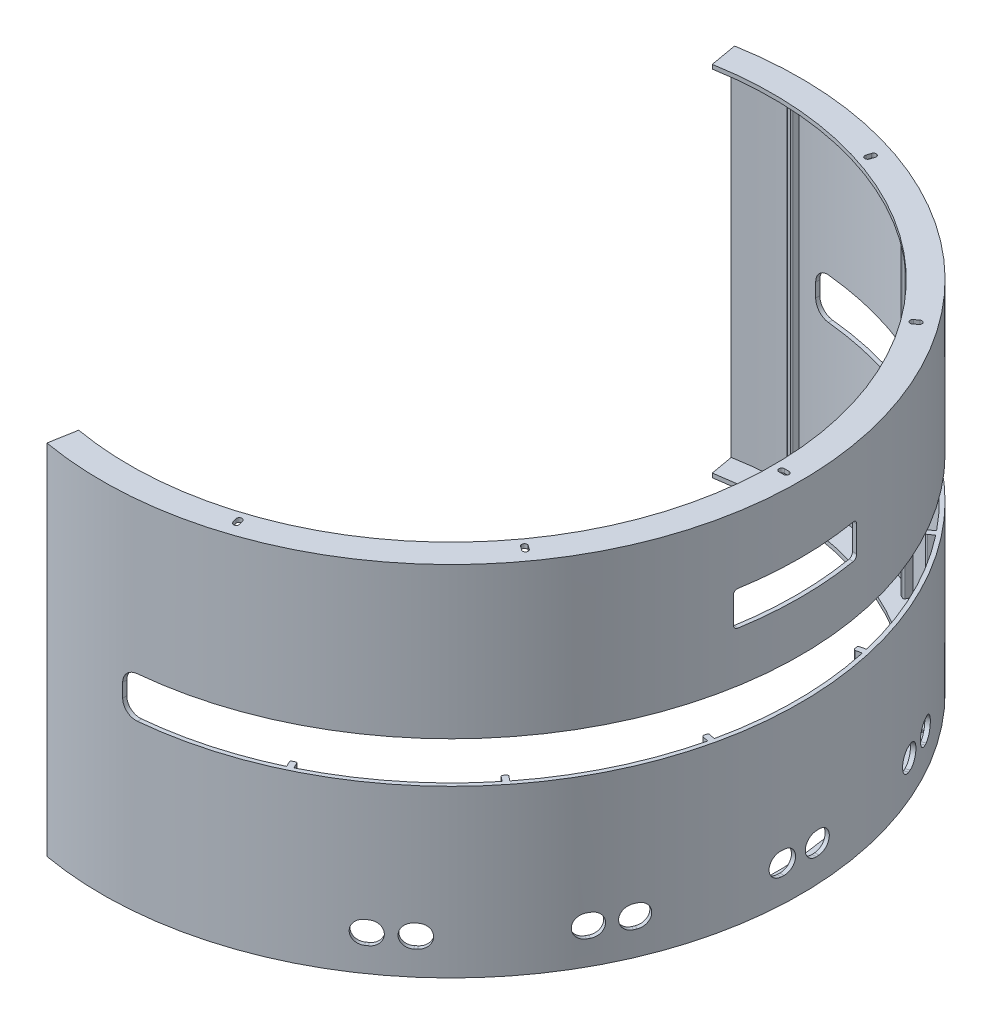
from build123d import *

# Parameters (mm, degrees)
BOSS_EXTRUDE1_DEPTH   = 255
BOSS_EXTRUDE2_DEPTH   = 255
BOSS_EXTRUDE2_2_DEPTH = 255
BOSS_EXTRUDE2_3_DEPTH = 255
BOSS_EXTRUDE2_4_DEPTH = 255
BOSS_EXTRUDE2_5_DEPTH = 255
BOSS_EXTRUDE2_6_DEPTH = 255
BOSS_EXTRUDE2_7_DEPTH = 255
BOSS_EXTRUDE2_8_DEPTH = 255
SKETCH4_W             = 480
SKETCH4_H             = 30
CUT_EXTRUDE2_DEPTH    = 476.5
FILLET2_R             = 10
BOSS_EXTRUDE3_DEPTH   = 3
CUT_EXTRUDE3_DEPTH    = 5
LPATTERN1_COUNT       = 2
LPATTERN1_PITCH       = 258
LPATTERN2_COUNT       = 2
LPATTERN2_PITCH       = 258
SKETCH9_W             = 27.100731328
SKETCH9_H             = 25
CUT_EXTRUDE4_DEPTH    = 45
FILLET3_R             = 3
CUT_EXTRUDE5_DEPTH    = 600
CIRPATTERN1_COUNT     = 3
CIRPATTERN1_ANGLE     = 52
CIRPATTERN2_COUNT     = 3
CIRPATTERN2_ANGLE     = 52


with BuildPart() as part:
    # Sketch3 → Boss-Extrude1 (new body)
    with BuildSketch(Plane(origin=(0, 0, 0), x_dir=(1, 0, 0), z_dir=(0, 1, 0))):
        with BuildLine():
            ThreePointArc((0, 251.5), (251.5, 0), (0, -251.5))
            ThreePointArc((0, -251.5), (-21.919669301, -250.54296657), (-43.672516683, -247.679149883))
            Line((-43.672516683, -247.679149883), (-44.193461216, -250.633573142))
            ThreePointArc((-44.193461216, -250.633573142), (-22.181136529, -253.531550664), (0, -254.5))
            ThreePointArc((0, -254.5), (254.5, 0), (0, 254.5))
            ThreePointArc((0, 254.5), (-22.181136529, 253.531550664), (-44.193461216, 250.633573142))
            Line((-44.193461216, 250.633573142), (-43.672516683, 247.679149883))
            ThreePointArc((-43.672516683, 247.679149883), (-21.919669301, 250.54296657), (0, 251.5))
        make_face()
    extrude(amount=BOSS_EXTRUDE1_DEPTH)


with BuildPart() as body_2:
    # Sketch6 → Boss-Extrude2 (new body)
    with BuildSketch(Plane(origin=(0, 255, 0), x_dir=(1, 0, 0), z_dir=(0, 1, 0))):
        with BuildLine():
            Line((-2, 253.081926056), (-2, 247.081926056))
            ThreePointArc((-2, 247.081926056), (-1.707106781, 246.374819275), (-1, 246.081926056))
            Line((-1, 246.081926056), (1, 246.081926056))
            ThreePointArc((1, 246.081926056), (1.707106781, 246.374819275), (2, 247.081926056))
            Line((2, 247.081926056), (2, 253.081926056))
            Line((2, 253.081926056), (-2, 253.081926056))
        make_face()
    extrude(amount=-BOSS_EXTRUDE2_DEPTH)


with BuildPart() as body_3:
    # Sketch6 → Boss-Extrude2 2 (new body)
    with BuildSketch(Plane(origin=(0, 255, 0), x_dir=(1, 0, 0), z_dir=(0, 1, 0))):
        with BuildLine():
            Line((108.006194645, 228.886703884), (105.40289221, 223.480890676))
            ThreePointArc((105.40289221, 223.480890676), (105.359977747, 222.716727875), (105.869977339, 222.146038069))
            Line((105.869977339, 222.146038069), (107.671915074, 221.278270591))
            ThreePointArc((107.671915074, 221.278270591), (108.436077876, 221.235356129), (109.006767681, 221.74535572))
            Line((109.006767681, 221.74535572), (111.610070116, 227.151168927))
            Line((111.610070116, 227.151168927), (108.006194645, 228.886703884))
        make_face()
    extrude(amount=-BOSS_EXTRUDE2_2_DEPTH)


with BuildPart() as body_4:
    # Sketch6 → Boss-Extrude2 3 (new body)
    with BuildSketch(Plane(origin=(0, 255, 0), x_dir=(1, 0, 0), z_dir=(0, 1, 0))):
        with BuildLine():
            Line((196.620437831, 159.357662896), (191.929448936, 155.616724085))
            ThreePointArc((191.929448936, 155.616724085), (191.559226528, 154.946857078), (191.771107255, 154.2114028))
            Line((191.771107255, 154.2114028), (193.018086859, 152.647739835))
            ThreePointArc((193.018086859, 152.647739835), (193.687953865, 152.277517427), (194.423408143, 152.489398155))
            Line((194.423408143, 152.489398155), (199.114397038, 156.230336966))
            Line((199.114397038, 156.230336966), (196.620437831, 159.357662896))
        make_face()
    extrude(amount=-BOSS_EXTRUDE2_3_DEPTH)


with BuildPart() as body_5:
    # Sketch6 → Boss-Extrude2 4 (new body)
    with BuildSketch(Plane(origin=(0, 255, 0), x_dir=(1, 0, 0), z_dir=(0, 1, 0))):
        with BuildLine():
            Line((246.291591913, 58.265882378), (240.44202444, 56.930756774))
            ThreePointArc((240.44202444, 56.930756774), (239.817821175, 56.487860938), (239.689617462, 55.733307928))
            Line((239.689617462, 55.733307928), (240.13465933, 53.783452104))
            ThreePointArc((240.13465933, 53.783452104), (240.577555165, 53.159248838), (241.332108176, 53.031045125))
            Line((241.332108176, 53.031045125), (247.181675649, 54.366170729))
            Line((247.181675649, 54.366170729), (246.291591913, 58.265882378))
        make_face()
    extrude(amount=-BOSS_EXTRUDE2_4_DEPTH)


with BuildPart() as body_6:
    # Sketch6 → Boss-Extrude2 5 (new body)
    with BuildSketch(Plane(origin=(0, 255, 0), x_dir=(1, 0, 0), z_dir=(0, 1, 0))):
        with BuildLine():
            Line((247.181675649, -54.366170729), (241.332108176, -53.031045125))
            ThreePointArc((241.332108176, -53.031045125), (240.577555165, -53.159248838), (240.13465933, -53.783452104))
            Line((240.13465933, -53.783452104), (239.689617462, -55.733307928))
            ThreePointArc((239.689617462, -55.733307928), (239.817821175, -56.487860938), (240.44202444, -56.930756774))
            Line((240.44202444, -56.930756774), (246.291591913, -58.265882378))
            Line((246.291591913, -58.265882378), (247.181675649, -54.366170729))
        make_face()
    extrude(amount=-BOSS_EXTRUDE2_5_DEPTH)


with BuildPart() as body_7:
    # Sketch6 → Boss-Extrude2 6 (new body)
    with BuildSketch(Plane(origin=(0, 255, 0), x_dir=(1, 0, 0), z_dir=(0, 1, 0))):
        with BuildLine():
            Line((199.114397038, -156.230336966), (194.423408143, -152.489398155))
            ThreePointArc((194.423408143, -152.489398155), (193.687953865, -152.277517427), (193.018086859, -152.647739835))
            Line((193.018086859, -152.647739835), (191.771107255, -154.2114028))
            ThreePointArc((191.771107255, -154.2114028), (191.559226528, -154.946857078), (191.929448936, -155.616724085))
            Line((191.929448936, -155.616724085), (196.620437831, -159.357662896))
            Line((196.620437831, -159.357662896), (199.114397038, -156.230336966))
        make_face()
    extrude(amount=-BOSS_EXTRUDE2_6_DEPTH)


with BuildPart() as body_8:
    # Sketch6 → Boss-Extrude2 7 (new body)
    with BuildSketch(Plane(origin=(0, 255, 0), x_dir=(1, 0, 0), z_dir=(0, 1, 0))):
        with BuildLine():
            Line((111.610070116, -227.151168927), (109.006767681, -221.74535572))
            ThreePointArc((109.006767681, -221.74535572), (108.436077876, -221.235356129), (107.671915074, -221.278270591))
            Line((107.671915074, -221.278270591), (105.869977339, -222.146038069))
            ThreePointArc((105.869977339, -222.146038069), (105.359977747, -222.716727875), (105.40289221, -223.480890676))
            Line((105.40289221, -223.480890676), (108.006194645, -228.886703884))
            Line((108.006194645, -228.886703884), (111.610070116, -227.151168927))
        make_face()
    extrude(amount=-BOSS_EXTRUDE2_7_DEPTH)


with BuildPart() as body_9:
    # Sketch6 → Boss-Extrude2 8 (new body)
    with BuildSketch(Plane(origin=(0, 255, 0), x_dir=(1, 0, 0), z_dir=(0, 1, 0))):
        with BuildLine():
            Line((2, -253.081926056), (2, -247.081926056))
            ThreePointArc((2, -247.081926056), (1.707106781, -246.374819275), (1, -246.081926056))
            Line((1, -246.081926056), (-1, -246.081926056))
            ThreePointArc((-1, -246.081926056), (-1.707106781, -246.374819275), (-2, -247.081926056))
            Line((-2, -247.081926056), (-2, -253.081926056))
            Line((-2, -253.081926056), (2, -253.081926056))
        make_face()
    extrude(amount=-BOSS_EXTRUDE2_8_DEPTH)


with BuildPart() as body_2_1:
    add(body_2.part)

    # Combine2: union part, body 3, body 4, body 5, body 6, body 7, body 8, body 9
    add(part.part)
    add(body_3.part)
    add(body_4.part)
    add(body_5.part)
    add(body_6.part)
    add(body_7.part)
    add(body_8.part)
    add(body_9.part)

    # Sketch4 → Cut-Extrude2 (cut, symmetric)
    with BuildSketch(Plane.XY):
        with Locations((254.5, 133)):
            Rectangle(SKETCH4_W, SKETCH4_H)
    extrude(amount=CUT_EXTRUDE2_DEPTH, both=True, mode=Mode.SUBTRACT)

    # Fillet2
    fillet2_edges = [body_2_1.edges().sort_by_distance(p)[0] for p in [
        (14.5, 148, -252.584129717),
        (14.5, 118, -252.584129717),
        (14.5, 118, 252.584129717),
        (14.5, 148, 252.584129717),
    ]]
    fillet(fillet2_edges, radius=FILLET2_R)

    # Sketch7 → Boss-Extrude3 (add)
    with BuildSketch(Plane(origin=(0, 255, 0), x_dir=(1, 0, 0), z_dir=(0, 1, 0))):
        with BuildLine():
            ThreePointArc((-44.193461216, -250.633573142), (254.5, 0), (-44.193461216, 250.633573142))
            Line((-44.193461216, 250.633573142), (-40.720497663, 230.937418081))
            ThreePointArc((-40.720497663, 230.937418081), (234.5, 0), (-40.720497663, -230.937418081))
            Line((-40.720497663, -230.937418081), (-44.193461216, -250.633573142))
        make_face()
    boss_extrude3 = extrude(amount=BOSS_EXTRUDE3_DEPTH)

    # Sketch8 → Cut-Extrude3 (cut)
    with BuildSketch(Plane.XZ.offset(-255)):
        with BuildLine():
            Line((240.8, 2), (244.2, 2))
            ThreePointArc((244.2, 2), (246.2, 0), (244.2, -2))
            Line((244.2, -2), (240.8, -2))
            ThreePointArc((240.8, -2), (238.8, 0), (240.8, 2))
        make_face()
        with BuildLine():
            Line((195.98686275, -139.920654763), (198.737520531, -141.919124621))
            ThreePointArc((198.737520531, -141.919124621), (199.179984015, -144.712729114), (196.386379522, -145.155192599))
            Line((196.386379522, -145.155192599), (193.635721741, -143.156722741))
            ThreePointArc((193.635721741, -143.156722741), (193.193258257, -140.363118247), (195.98686275, -139.920654763))
        make_face()
        with BuildLine():
            Line((76.313405278, -228.396375135), (77.364063059, -231.629967291))
            ThreePointArc((77.364063059, -231.629967291), (76.079984015, -234.150114312), (73.559836994, -232.866035268))
            Line((73.559836994, -232.866035268), (72.509179213, -229.632443113))
            ThreePointArc((72.509179213, -229.632443113), (73.793258257, -227.112296091), (76.313405278, -228.396375135))
        make_face()
        with BuildLine():
            Line((-72.509179213, -229.632443113), (-73.559836994, -232.866035268))
            ThreePointArc((-73.559836994, -232.866035268), (-76.079984015, -234.150114312), (-77.364063059, -231.629967291))
            Line((-77.364063059, -231.629967291), (-76.313405278, -228.396375135))
            ThreePointArc((-76.313405278, -228.396375135), (-73.793258257, -227.112296091), (-72.509179213, -229.632443113))
        make_face()
        with BuildLine():
            Line((-193.635721741, -143.156722741), (-196.386379522, -145.155192599))
            ThreePointArc((-196.386379522, -145.155192599), (-199.179984015, -144.712729114), (-198.737520531, -141.919124621))
            Line((-198.737520531, -141.919124621), (-195.98686275, -139.920654763))
            ThreePointArc((-195.98686275, -139.920654763), (-193.193258257, -140.363118247), (-193.635721741, -143.156722741))
        make_face()
        with BuildLine():
            Line((-240.8, -2), (-244.2, -2))
            ThreePointArc((-244.2, -2), (-246.2, 0), (-244.2, 2))
            Line((-244.2, 2), (-240.8, 2))
            ThreePointArc((-240.8, 2), (-238.8, 0), (-240.8, -2))
        make_face()
        with BuildLine():
            Line((-195.98686275, 139.920654763), (-198.737520531, 141.919124621))
            ThreePointArc((-198.737520531, 141.919124621), (-199.179984015, 144.712729114), (-196.386379522, 145.155192599))
            Line((-196.386379522, 145.155192599), (-193.635721741, 143.156722741))
            ThreePointArc((-193.635721741, 143.156722741), (-193.193258257, 140.363118247), (-195.98686275, 139.920654763))
        make_face()
        with BuildLine():
            Line((-76.313405278, 228.396375135), (-77.364063059, 231.629967291))
            ThreePointArc((-77.364063059, 231.629967291), (-76.079984015, 234.150114312), (-73.559836994, 232.866035268))
            Line((-73.559836994, 232.866035268), (-72.509179213, 229.632443113))
            ThreePointArc((-72.509179213, 229.632443113), (-73.793258257, 227.112296091), (-76.313405278, 228.396375135))
        make_face()
        with BuildLine():
            Line((72.509179213, 229.632443113), (73.559836994, 232.866035268))
            ThreePointArc((73.559836994, 232.866035268), (76.079984015, 234.150114312), (77.364063059, 231.629967291))
            Line((77.364063059, 231.629967291), (76.313405278, 228.396375135))
            ThreePointArc((76.313405278, 228.396375135), (73.793258257, 227.112296091), (72.509179213, 229.632443113))
        make_face()
        with BuildLine():
            Line((193.635721741, 143.156722741), (196.386379522, 145.155192599))
            ThreePointArc((196.386379522, 145.155192599), (199.179984015, 144.712729114), (198.737520531, 141.919124621))
            Line((198.737520531, 141.919124621), (195.98686275, 139.920654763))
            ThreePointArc((195.98686275, 139.920654763), (193.193258257, 140.363118247), (193.635721741, 143.156722741))
        make_face()
    cut_extrude3 = extrude(amount=-CUT_EXTRUDE3_DEPTH, mode=Mode.SUBTRACT)

    # LPattern1: Boss-Extrude3 ×2
    with Locations(*[(0, -i * LPATTERN1_PITCH, 0) for i in range(1, LPATTERN1_COUNT)]):
        add(boss_extrude3)

    # LPattern2: Cut-Extrude3 ×2
    with Locations(*[(0, -i * LPATTERN2_PITCH, 0) for i in range(1, LPATTERN2_COUNT)]):
        add(cut_extrude3, mode=Mode.SUBTRACT)

    # Sketch9 → Cut-Extrude4 (cut, symmetric)
    with BuildSketch(Plane.XY):
        with Locations((254.5, 197)):
            Rectangle(SKETCH9_W, SKETCH9_H)
    extrude(amount=CUT_EXTRUDE4_DEPTH, both=True, mode=Mode.SUBTRACT)

    # Fillet3
    fillet3_edges = [body_2_1.edges().sort_by_distance(p)[0] for p in [
        (248.965713484, 209.5, 45),
        (248.965713484, 184.5, 45),
        (248.965713484, 184.5, -45),
        (248.965713484, 209.5, -45),
    ]]
    fillet(fillet3_edges, radius=FILLET3_R)

    # Sketch10 → Cut-Extrude5 (cut)
    with BuildSketch(Plane(origin=(0, 0, 0), x_dir=(0, 0, -1), z_dir=(1, 0, 0))):
        with BuildLine():
            Line((13.75, 14.8), (11.75, 14.8))
            ThreePointArc((11.75, 14.8), (3.55, 23), (11.75, 31.2))
            Line((11.75, 31.2), (13.75, 31.2))
            ThreePointArc((13.75, 31.2), (21.95, 23), (13.75, 14.8))
        make_face()
        with BuildLine():
            Line((-13.75, 14.8), (-11.75, 14.8))
            ThreePointArc((-11.75, 14.8), (-3.55, 23), (-11.75, 31.2))
            Line((-11.75, 31.2), (-13.75, 31.2))
            ThreePointArc((-13.75, 31.2), (-21.95, 23), (-13.75, 14.8))
        make_face()
    cut_extrude5 = extrude(amount=CUT_EXTRUDE5_DEPTH, mode=Mode.SUBTRACT)

    # CirPattern1: Cut-Extrude5 ×3 about axis
    cirpattern1_axis = Axis((0, 255, 0), (0, 1, 0))
    for i in range(1, CIRPATTERN1_COUNT):
        add(cut_extrude5.rotate(cirpattern1_axis, i * CIRPATTERN1_ANGLE / (CIRPATTERN1_COUNT - 1)), mode=Mode.SUBTRACT)

    # CirPattern2: Cut-Extrude5 ×3 about axis
    cirpattern2_axis = Axis((0, 255, 0), (0, -1, 0))
    for i in range(1, CIRPATTERN2_COUNT):
        add(cut_extrude5.rotate(cirpattern2_axis, i * CIRPATTERN2_ANGLE / (CIRPATTERN2_COUNT - 1)), mode=Mode.SUBTRACT)


solid = body_2_1.part
